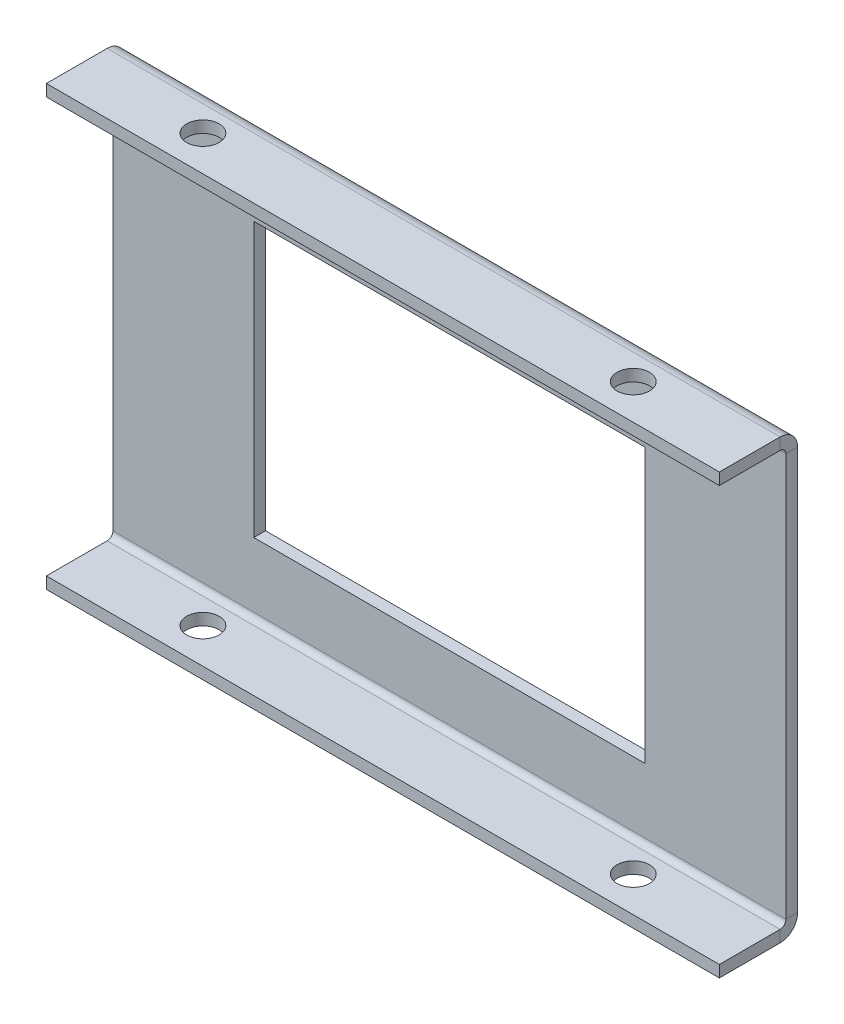
from build123d import *

# Parameters (mm, degrees)
SKETCH_2_W                       = 86
SKETCH_2_H                       = 1.5
SM_BASE_FLANGE_1_DEPTH           = 10
SM_EDGE_FLANGE_1_STRIP_W         = 7.4732
SM_EDGE_FLANGE_1_STRIP_H         = 1.5
SM_EDGE_FLANGE_1_STRIP_CUT_DEPTH = 86
SM_EDGE_FLANGE_1_DEPTH           = 86
SM_EDGE_FLANGE_2_STRIP_W         = 7.4732
SM_EDGE_FLANGE_2_STRIP_H         = 1.5
SM_EDGE_FLANGE_2_STRIP_CUT_DEPTH = 86
SM_EDGE_FLANGE_2_DEPTH           = 86
SKETCH_13_W                      = 50
SKETCH_13_H                      = 35
CUT_EXTRUDE_1_DEPTH              = 10
SKETCH_14_R                      = 2.072907101
CUT_EXTRUDE_2_DEPTH              = 104.111590037


# Sheet-metal steps are written as plain solids
with BuildPart() as part:
    # Sketch 2 → 基体-法兰1 (new body)
    with BuildSketch(Plane.XY):
        with Locations((43, -0.75)):
            Rectangle(SKETCH_2_W, SKETCH_2_H)
    extrude(amount=SM_BASE_FLANGE_1_DEPTH)

    # 边线-法兰1 strip (across the edge) → 边线-法兰1 strip cut (cut)
    with BuildSketch(Plane.ZY.offset(-86)):
        with Locations((-1.5, -0.75)):
            Rectangle(SM_EDGE_FLANGE_1_STRIP_W, SM_EDGE_FLANGE_1_STRIP_H)
    extrude(amount=SM_EDGE_FLANGE_1_STRIP_CUT_DEPTH, mode=Mode.SUBTRACT)

    # 边线-法兰1 section (across the edge) → 边线-法兰1 (add)
    with BuildSketch(Plane.ZY.offset(-86)):
        with BuildLine():
            Line((0, 0.7366), (0, 54.5))
            Line((0, 54.5), (1.5, 54.5))
            Line((1.5, 54.5), (1.5, 0.7366))
            ThreePointArc((1.5, 0.7366), (1.715745145, 0.215745145), (2.2366, 0))
            Line((2.2366, 0), (2.2366, -1.5))
            ThreePointArc((2.2366, -1.5), (0.655084973, -0.844915027), (0, 0.7366))
        make_face()
    extrude(amount=SM_EDGE_FLANGE_1_DEPTH)

    # 边线-法兰2 strip (across the edge) → 边线-法兰2 strip cut (cut)
    with BuildSketch(Plane(origin=(86, 54.5, 1.5), x_dir=(0, -1, 0), z_dir=(-1, 0, 0))):
        with Locations((-1.5, -0.75)):
            Rectangle(SM_EDGE_FLANGE_2_STRIP_W, SM_EDGE_FLANGE_2_STRIP_H)
    extrude(amount=SM_EDGE_FLANGE_2_STRIP_CUT_DEPTH, mode=Mode.SUBTRACT)

    # 边线-法兰2 section (across the edge) → 边线-法兰2 (add)
    with BuildSketch(Plane(origin=(86, 54.5, 1.5), x_dir=(0, -1, 0), z_dir=(-1, 0, 0))):
        with BuildLine():
            Line((0, 0.7366), (0, 8.5))
            Line((0, 8.5), (1.5, 8.5))
            Line((1.5, 8.5), (1.5, 0.7366))
            ThreePointArc((1.5, 0.7366), (1.715745145, 0.215745145), (2.2366, 0))
            Line((2.2366, 0), (2.2366, -1.5))
            ThreePointArc((2.2366, -1.5), (0.655084973, -0.844915027), (0, 0.7366))
        make_face()
    extrude(amount=SM_EDGE_FLANGE_2_DEPTH)

    # 草图13 → 切除-拉伸1 (cut)
    with BuildSketch(Plane(origin=(0, 0, 0), x_dir=(-1, 0, 0), z_dir=(0, 0, -1))):
        with Locations((-43, 26.5)):
            Rectangle(SKETCH_13_W, SKETCH_13_H)
    extrude(amount=-CUT_EXTRUDE_1_DEPTH, mode=Mode.SUBTRACT)

    # 草图14 → 切除-拉伸2 (cut, through all)
    with BuildSketch(Plane(origin=(0, 54.5, 0), x_dir=(1, 0, 0), z_dir=(0, 1, 0))):
        with Locations(Location((15.5, -5.5, 0), (0, 0, 270))):
            Circle(SKETCH_14_R)
        with Locations(Location((70.5, -5.5, 0), (0, 0, 270))):
            Circle(SKETCH_14_R)
    extrude(amount=-CUT_EXTRUDE_2_DEPTH, mode=Mode.SUBTRACT)


solid = part.part
